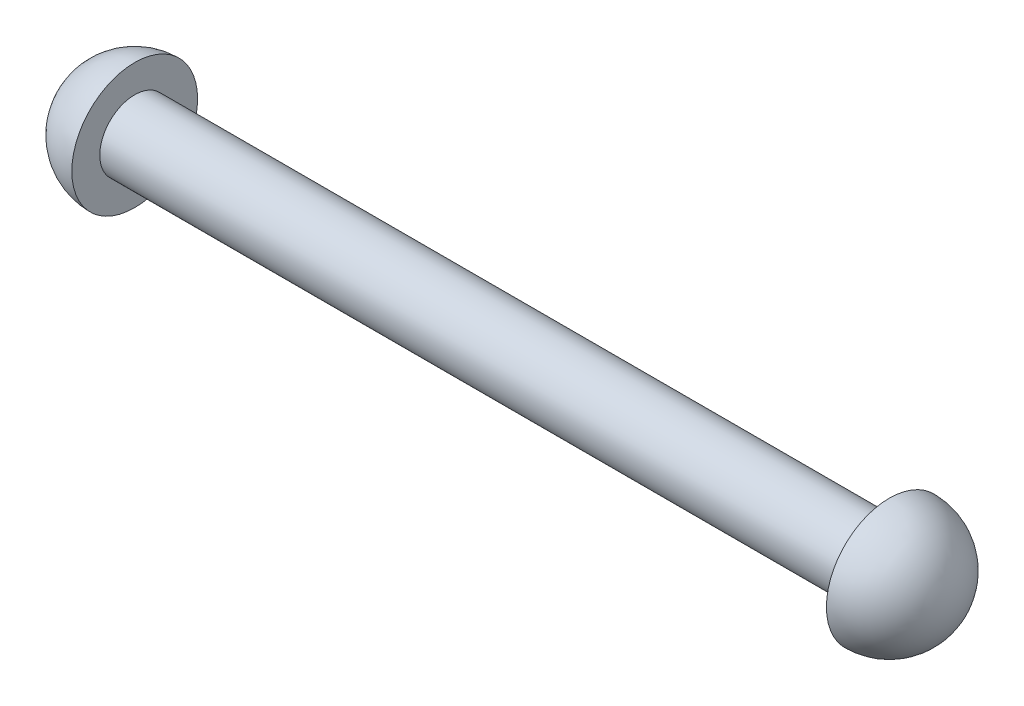
from build123d import *


with BuildPart() as part:
    # Sketch1 → Revolve1 (revolve)
    with BuildSketch(Plane.XY):
        with BuildLine():
            Line((0, 6.35), (0, 8.89))
            ThreePointArc((0, 8.89), (-4.041115254, 7.216115254), (-5.715, 3.175))
            Line((-5.715, 3.175), (74.295, 3.175))
            ThreePointArc((74.295, 3.175), (72.621115254, 7.216115254), (68.58, 8.89))
            Line((68.58, 8.89), (68.58, 6.35))
            Line((68.58, 6.35), (0, 6.35))
        make_face()
    revolve(axis=Axis((-5.715, 3.175, 0), (1, 0, 0)))


solid = part.part
